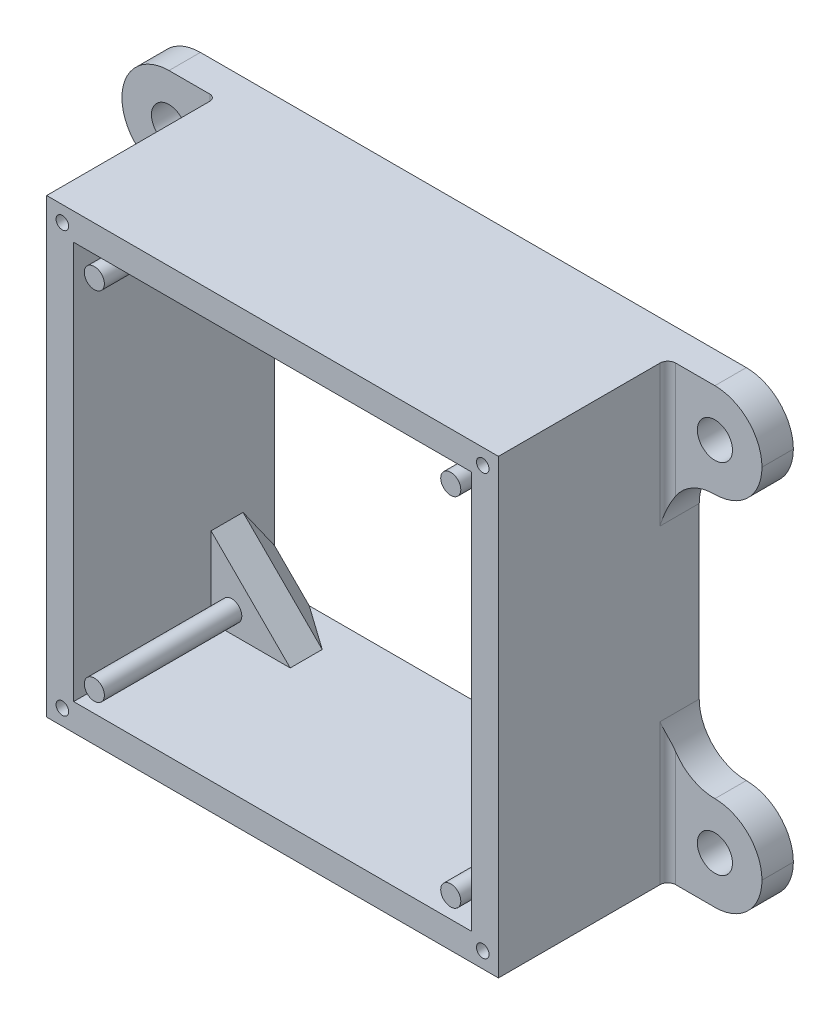
from build123d import *

# Parameters (mm, degrees)
SKETCH1_W           = 80.01
SKETCH1_H           = 80.01
BOSS_EXTRUDE1_DEPTH = 12.827
SKETCH2_R           = 2.032
BOSS_EXTRUDE2_DEPTH = 27.813
SKETCH3_W           = 91.44
SKETCH3_H           = 91.44
SKETCH3_W_2         = 80.01
SKETCH3_H_2         = 80.01
BOSS_EXTRUDE3_DEPTH = 40.64
CUT_EXTRUDE1_DEPTH  = 71.386076528
SKETCH6_W           = 80.518
SKETCH6_H           = 80.518
SKETCH6_W_2         = 80.01
SKETCH6_H_2         = 80.01
CUT_EXTRUDE2_DEPTH  = 27.813
CUT_EXTRUDE3_DEPTH  = 71.386076528
SKETCH9_W           = 19.05
SKETCH9_H           = 19.05
SKETCH9_R           = 3.556
BOSS_EXTRUDE4_DEPTH = 6.35
FILLET1_R           = 9.525
FILLET2_R           = 1.27
FILLET3_R           = 9.525
FILLET4_R           = 1.5875
SKETCH10_R          = 1.27
CUT_EXTRUDE4_DEPTH  = 7.62
CHAMFER2_SIZE       = 6.35


with BuildPart() as part:
    # Sketch1 → Boss-Extrude1 (new body)
    with BuildSketch(Plane.XY):
        Rectangle(SKETCH1_W, SKETCH1_H)
    extrude(amount=BOSS_EXTRUDE1_DEPTH)

    # Sketch2 → Boss-Extrude2 (add)
    with BuildSketch(Plane.XY.offset(12.827)):
        with Locations(Location((-36.068, 36.068, 0), (0, 0, 180))):
            Circle(SKETCH2_R)
        with Locations(Location((36.068, 36.068, 0), (0, 0, 180))):
            Circle(SKETCH2_R)
        with Locations(Location((36.068, -36.068, 0), (0, 0, 180))):
            Circle(SKETCH2_R)
        with Locations(Location((-36.068, -36.068, 0), (0, 0, 180))):
            Circle(SKETCH2_R)
    extrude(amount=BOSS_EXTRUDE2_DEPTH)

    # Sketch3 → Boss-Extrude3 (add, through all)
    with BuildSketch(Plane(origin=(0, 0, 0), x_dir=(-1, 0, 0), z_dir=(0, 0, -1))):
        Rectangle(SKETCH3_W, SKETCH3_H)
        Rectangle(SKETCH3_W_2, SKETCH3_H_2, mode=Mode.SUBTRACT)
    extrude(amount=-BOSS_EXTRUDE3_DEPTH)

    # Sketch4 → Cut-Extrude1 (cut, through all)
    with BuildSketch(Plane.XY.offset(12.827)):
        Polygon((24.13, 40.005), (40.005, 24.13), (40.005, -24.13), (24.13, -40.005), (-24.13, -40.005), (-40.005, -24.13), (-40.005, 24.13), (-24.13, 40.005), align=None)
    extrude(amount=-CUT_EXTRUDE1_DEPTH, mode=Mode.SUBTRACT)

    # Sketch6 → Cut-Extrude2 (cut)
    with BuildSketch(Plane.XY.offset(40.64)):
        Rectangle(SKETCH6_W, SKETCH6_H)
        Rectangle(SKETCH6_W_2, SKETCH6_H_2, mode=Mode.SUBTRACT)
    extrude(amount=-CUT_EXTRUDE2_DEPTH, mode=Mode.SUBTRACT)

    # Sketch7 → Cut-Extrude3 (cut, through all)
    with BuildSketch(Plane.XY.offset(12.827)):
        Polygon((-40.259, 24.235210245), (-40.259, -24.235210245), (-24.235210245, -40.259), (24.235210245, -40.259), (40.259, -24.235210245), (40.259, 24.235210245), (24.235210245, 40.259), (-24.235210245, 40.259), align=None)
        Polygon((-40.005, 24.13), (-40.005, -24.13), (-24.13, -40.005), (24.13, -40.005), (40.005, -24.13), (40.005, 24.13), (24.13, 40.005), (-24.13, 40.005), align=None, mode=Mode.SUBTRACT)
    extrude(amount=-CUT_EXTRUDE3_DEPTH, mode=Mode.SUBTRACT)

    # Sketch9 → Boss-Extrude4 (add)
    # profile 1 of 2: a face of its own
    with BuildSketch(Plane(origin=(0, 0, 0), x_dir=(-1, 0, 0), z_dir=(0, 0, -1))):
        with Locations((55.245, -36.195)):
            Rectangle(SKETCH9_W, SKETCH9_H)
        with Locations((55.245, -36.195)):
            Circle(SKETCH9_R, mode=Mode.SUBTRACT)
    # profile 2 of 2: a face of its own
    with BuildSketch(Plane(origin=(0, 0, 0), x_dir=(-1, 0, 0), z_dir=(0, 0, -1))):
        with Locations((55.245, 36.195)):
            Rectangle(SKETCH9_W, SKETCH9_H)
        with Locations(Location((55.245, 36.195, 0), (0, 0, 180))):
            Circle(SKETCH9_R, mode=Mode.SUBTRACT)
    boss_extrude4 = extrude(amount=-BOSS_EXTRUDE4_DEPTH)

    # Fillet1
    fillet1_edges = [part.edges().sort_by_distance(p)[0] for p in [
        (-45.72, 26.67, 3.175),
        (-45.72, -26.67, 3.175),
        (-64.77, -45.72, 3.175),
        (-64.77, -26.67, 3.175),
        (-64.77, 26.67, 3.175),
        (-64.77, 45.72, 3.175),
    ]]
    fillet(fillet1_edges, radius=FILLET1_R - 0.0001)  # a hair under: the kernel refuses the full size

    # Fillet2
    fillet2_edges = [part.edges().sort_by_distance(p)[0] for p in [
        (-45.72, -31.43255, 6.35),
        (-45.72, 31.43255, 6.35),
    ]]
    fillet(fillet2_edges, radius=FILLET2_R)

    # Mirror4: Boss-Extrude4 across plane
    add(boss_extrude4.mirror(Plane(origin=(0, 0, 0), x_dir=(0, 0, 1), z_dir=(1, 0, 0))))

    # Fillet3
    fillet3_edges = [part.edges().sort_by_distance(p)[0] for p in [
        (45.72, -26.67, 3.175),
        (64.77, -26.67, 3.175),
        (64.77, -45.72, 3.175),
        (45.72, 26.67, 3.175),
        (64.77, 26.67, 3.175),
        (64.77, 45.72, 3.175),
    ]]
    fillet(fillet3_edges, radius=FILLET3_R - 0.0001)  # a hair under: the kernel refuses the full size

    # Fillet4
    fillet4_edges = [part.edges().sort_by_distance(p)[0] for p in [
        (45.72, -31.43255, 6.35),
        (45.72, 31.43255, 6.35),
    ]]
    fillet(fillet4_edges, radius=FILLET4_R)

    # Sketch10 → Cut-Extrude4 (cut)
    with BuildSketch(Plane.XY.offset(40.64)):
        with Locations((-42.545, 42.545)):
            Circle(SKETCH10_R)
        with Locations((42.545, 42.545)):
            Circle(SKETCH10_R)
        with Locations((42.545, -42.545)):
            Circle(SKETCH10_R)
        with Locations((-42.545, -42.545)):
            Circle(SKETCH10_R)
    extrude(amount=-CUT_EXTRUDE4_DEPTH, mode=Mode.SUBTRACT)

    # Chamfer2
    chamfer2_edges = [part.edges().sort_by_distance(p)[0] for p in [
        (-32.247105122, 32.247105122, 0),
        (32.247105122, 32.247105122, 0),
        (32.247105122, -32.247105122, 0),
        (-32.247105122, -32.247105122, 0),
    ]]
    chamfer(chamfer2_edges, length=CHAMFER2_SIZE)


solid = part.part
